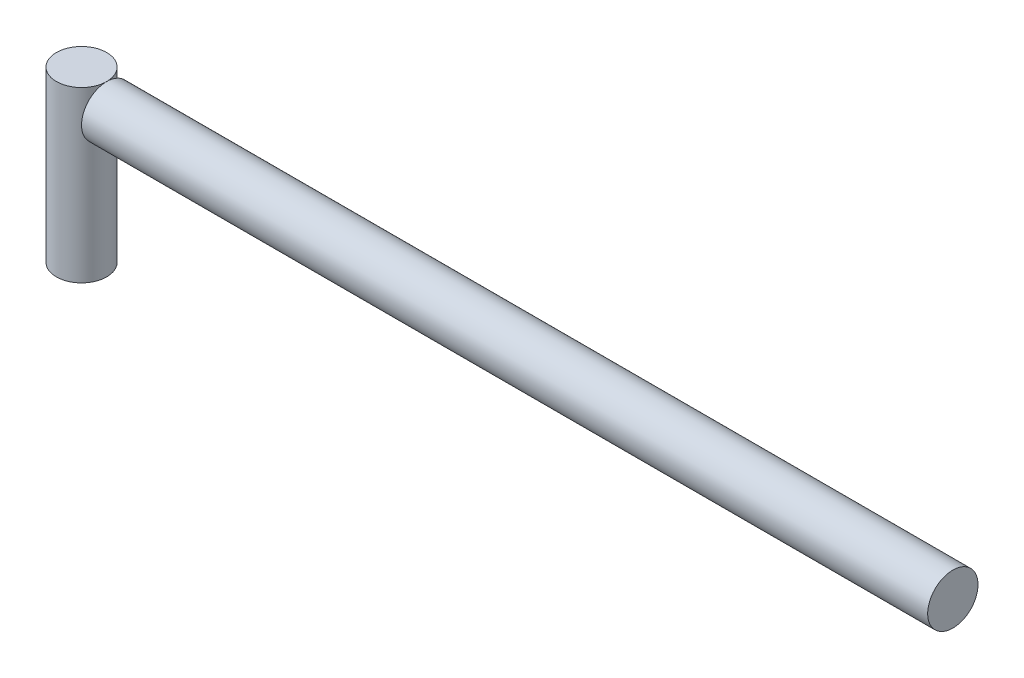
from build123d import *

# Parameters (mm, degrees)
SKETCH1_R               = 5.5
BOSS_EXTRUDE1_DEPTH     = 37
BOSS_EXTRUDE2_START     = 5.5
BOSS_EXTRUDE2_OUTLINE_R = 5.5
BOSS_EXTRUDE2_DEPTH     = 185
SKETCH2_R               = 1.55
CUT_EXTRUDE1_DEPTH      = 11.72


# Read off the part's stored shape, not the designer's step: Boss-Extrude2
with BuildPart() as part:
    # Sketch1 → Boss-Extrude1 (new body)
    with BuildSketch(Plane(origin=(0, 0, 0), x_dir=(1, 0, 0), z_dir=(0, 1, 0))):
        with Locations(Location((0, 0, 0), (0, 0, 270))):
            Circle(SKETCH1_R)
    extrude(amount=BOSS_EXTRUDE1_DEPTH)

    # Sketch2 → Cut-Extrude1 (cut)
    with BuildSketch(Plane.XZ):
        with Locations(Location((0, 0, 0), (0, 0, 270))):
            Circle(SKETCH2_R)
    extrude(amount=-CUT_EXTRUDE1_DEPTH, mode=Mode.SUBTRACT)


with BuildPart() as body_2:
    # Boss-Extrude2 outline → Boss-Extrude2 (new body)
    with BuildSketch(Plane.YZ.offset(BOSS_EXTRUDE2_START)):
        with Locations((31.5, 0)):
            Circle(BOSS_EXTRUDE2_OUTLINE_R)
    extrude(amount=BOSS_EXTRUDE2_DEPTH)


solid = Compound([part.part, body_2.part])
